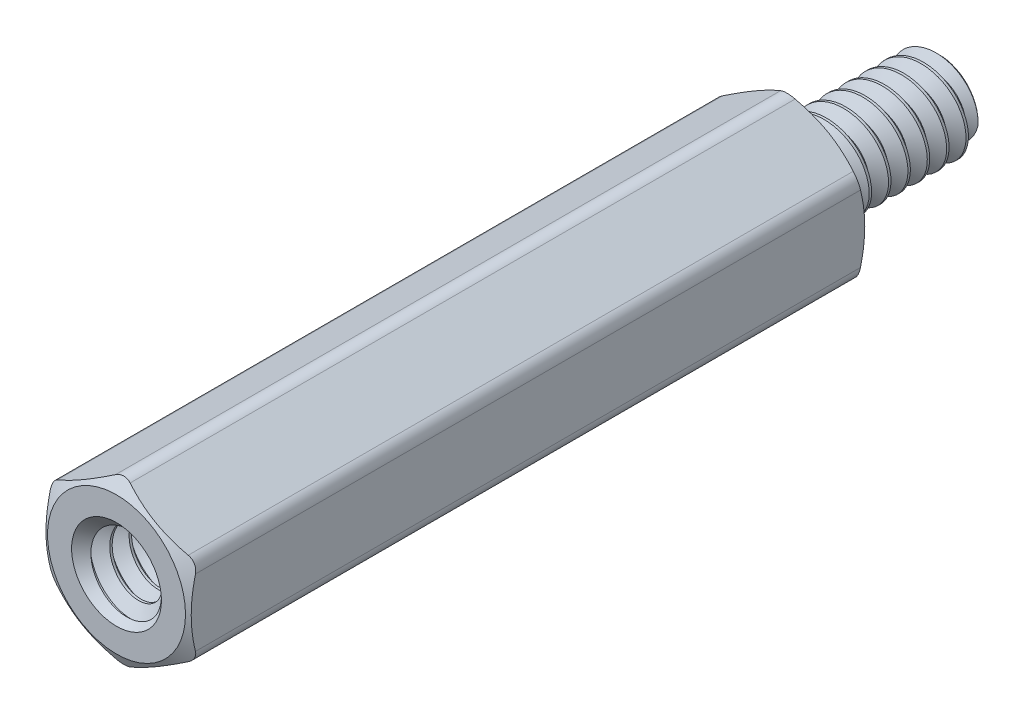
from build123d import *

# Parameters (mm, degrees)
SKETCH4_R           = 1.901825
BOSS_EXTRUDE1_DEPTH = 22.225
SKETCH5_OUTSIDE_W   = 110.15
SKETCH5_OUTSIDE_H   = 110.888
SKETCH5_OUTSIDE_R   = 2.2621875
CUT_EXTRUDE1_DEPTH  = 28.231525417
CUT_EXTRUDE1_DRAFT  = -60
SKETCH6_OUTSIDE_W   = 93.83
SKETCH6_OUTSIDE_H   = 94.568
SKETCH6_OUTSIDE_R   = 2.2621875
CUT_EXTRUDE2_DEPTH  = 23.520689273
CUT_EXTRUDE2_DRAFT  = -60
FILLET1_R           = 0.47625
CUT_SWEEP1_PITCH    = 0.635
SKETCH9_R           = 1.58115
BOSS_EXTRUDE2_DEPTH = 6.35
SKETCH10_W          = 6.35
SKETCH10_H          = 1.4224
CUT_SWEEP2_PITCH    = 0.635


with BuildPart() as part:
    # Sketch3 → Revolve1 (revolve)
    with BuildSketch(Plane(origin=(0, 0, 0), x_dir=(0, 0, -1), z_dir=(1, 0, 0))):
        with BuildLine():
            Line((-15.875, 1.26365), (-15.875, 0))
            Line((-15.875, 0), (4.7625, 0))
            Line((4.7625, 0), (4.7625, 1.26365))
            Line((4.7625, 1.26365), (4.60375, 1.4224))
            Line((4.60375, 1.4224), (0.809625, 1.4224))
            Line((0.809625, 1.4224), (0.5715, 1.009955401))
            Line((0.5715, 1.009955401), (0.15875, 1.009955401))
            ThreePointArc((0.15875, 1.009955401), (0.046496798, 1.0564522), (0, 1.168705401))
            Line((0, 1.168705401), (0, 2.38125))
            Line((0, 2.38125), (-22.225, 2.38125))
            Line((-22.225, 2.38125), (-22.225, 1.58115))
            Line((-22.225, 1.58115), (-22.06625, 1.4224))
            Line((-22.06625, 1.4224), (-16.03375, 1.4224))
            Line((-16.03375, 1.4224), (-15.875, 1.26365))
        make_face()
    revolve(axis=Axis((0, 0, -4.7625), (0, 0, 1)))

    # Sketch4 → Boss-Extrude1 (add)
    with BuildSketch(Plane.XY.offset(22.225)):
        Polygon((-2.38125, 1.374815329), (-2.38125, -1.374815329), (0, -2.749630657), (2.38125, -1.374815329), (2.38125, 1.374815329), (0, 2.749630657), align=None)
        Circle(SKETCH4_R, mode=Mode.SUBTRACT)
    extrude(amount=-BOSS_EXTRUDE1_DEPTH)


with BuildPart() as cut_extrude1_tool:
    # Sketch5 outside → Cut-Extrude1 (with draft: the straight prism first)
    with BuildSketch(Plane.XY.offset(22.225)):
        Rectangle(SKETCH5_OUTSIDE_W, SKETCH5_OUTSIDE_H)
        Circle(SKETCH5_OUTSIDE_R, mode=Mode.SUBTRACT)
    extrude(amount=-CUT_EXTRUDE1_DEPTH)
    # Cut-Extrude1: the draft: its side faces are tilted about the plane it starts from
    cut_extrude1_sides = [cut_extrude1_tool.faces().sort_by_distance(p)[0] for p in [
        (0, -55.444, 8.109237291),
        (55.075, 0, 8.109237291),
        (0, 55.444, 8.109237291),
        (-55.075, 0, 8.109237291),
        (-2.2621875, 0, 8.109237291),
    ]]
    draft(cut_extrude1_sides, Plane.XY.offset(22.225), CUT_EXTRUDE1_DRAFT)


with BuildPart() as part_1:
    add(part.part)

    # Cut-Extrude1: cut by cut_extrude1_tool
    add(cut_extrude1_tool.part, mode=Mode.SUBTRACT)


with BuildPart() as cut_extrude2_tool:
    # Sketch6 outside → Cut-Extrude2 (with draft: the straight prism first)
    with BuildSketch(Plane(origin=(0, 0, 0), x_dir=(-1, 0, 0), z_dir=(0, 0, -1))):
        Rectangle(SKETCH6_OUTSIDE_W, SKETCH6_OUTSIDE_H)
        Circle(SKETCH6_OUTSIDE_R, mode=Mode.SUBTRACT)
    extrude(amount=-CUT_EXTRUDE2_DEPTH)
    # Cut-Extrude2: the draft: its side faces are tilted about the plane it starts from
    cut_extrude2_sides = [cut_extrude2_tool.faces().sort_by_distance(p)[0] for p in [
        (0, -47.284, 11.760344636),
        (-46.915, 0, 11.760344636),
        (0, 47.284, 11.760344636),
        (46.915, 0, 11.760344636),
        (2.2621875, 0, 11.760344636),
    ]]
    draft(cut_extrude2_sides, Plane(origin=(0, 0, 0), x_dir=(-1, 0, 0), z_dir=(0, 0, -1)), CUT_EXTRUDE2_DRAFT)


with BuildPart() as part_2:
    add(part_1.part)

    # Cut-Extrude2: cut by cut_extrude2_tool
    add(cut_extrude2_tool.part, mode=Mode.SUBTRACT)

    # Fillet1
    fillet1_edges = [part_2.edges().sort_by_distance(p)[0] for p in [
        (0, 2.749630657, 11.1125),
        (-2.38125, -1.374815329, 11.1125),
        (0, -2.749630657, 11.1125),
        (2.38125, -1.374815329, 11.1125),
        (2.38125, 1.374815329, 11.1125),
        (-2.38125, 1.374815329, 11.1125),
    ]]
    fillet(fillet1_edges, radius=FILLET1_R)

    # Cut-Sweep1: the profile of Sketch7 profile screwed along a right-hand helix of 7.275 turns, 6 arcs to a turn; built about Z, then put on its axis
    cut_sweep1_z = Axis((0, 0, 0), (0, 0, 1))
    cut_sweep1_corners = [(1.009655401, 0, -0.238298205), (1.009655401, 0, -0.317326795), (1.456770383, 0, -0.57546875), (1.456770383, 0, 0.01984375)]
    with BuildLine(mode=Mode.PRIVATE) as cut_sweep1_profile:
        Line(cut_sweep1_corners[0], cut_sweep1_corners[1])
        Line(cut_sweep1_corners[1], cut_sweep1_corners[2])
        Line(cut_sweep1_corners[2], cut_sweep1_corners[3])
        Line(cut_sweep1_corners[3], cut_sweep1_corners[0])
    cut_sweep1_cap = Face(cut_sweep1_profile.wire())
    cut_sweep1_turn_angles = [0, 30, 60, 90, 120, 150, 180, 210, 240, 270, 300, 330, 360]
    cut_sweep1_turn_weights = [1, 0.8660254037844387, 1, 0.8660254037844387, 1, 0.8660254037844387, 1, 0.8660254037844387, 1, 0.8660254037844387, 1, 0.8660254037844387, 1]
    cut_sweep1_turn_rails = [Edge.make_bspline([Vector(p[0], p[1], 0).rotate(cut_sweep1_z, cut_sweep1_turn_angles[k]) / cut_sweep1_turn_weights[k] + Vector(0, 0, p[2] + CUT_SWEEP1_PITCH * cut_sweep1_turn_angles[k] / 360) for k in range(13)], [0, 0, 0, 1, 1, 2, 2, 3, 3, 4, 4, 5, 5, 6, 6, 6], 2, cut_sweep1_turn_weights) for p in cut_sweep1_corners]
    cut_sweep1_turn_sides = [Face.make_surface_from_curves(cut_sweep1_turn_rails[p[0]], cut_sweep1_turn_rails[p[1]]) for p in [(0, 1), (1, 2), (2, 3), (3, 0)]]
    cut_sweep1_last_angles = [2520, 2550, 2580, 2599.5, 2619]
    cut_sweep1_last_weights = [1, 0.8660254037844387, 1, 0.9426414910921771, 1]
    cut_sweep1_last_rails = [Edge.make_bspline([Vector(p[0], p[1], 0).rotate(cut_sweep1_z, cut_sweep1_last_angles[k]) / cut_sweep1_last_weights[k] + Vector(0, 0, p[2] + CUT_SWEEP1_PITCH * cut_sweep1_last_angles[k] / 360) for k in range(5)], [0, 0, 0, 1, 1, 2, 2, 2], 2, cut_sweep1_last_weights) for p in cut_sweep1_corners]
    cut_sweep1_last_sides = [Face.make_surface_from_curves(cut_sweep1_last_rails[p[0]], cut_sweep1_last_rails[p[1]]) for p in [(0, 1), (1, 2), (2, 3), (3, 0)]]
    cut_sweep1 = Plane(origin=(0, 0, -4.7625), x_dir=(0, 1, 0), z_dir=(0, 0, 1)) * Solid(Shell([*[p.moved(Location((0, 0, CUT_SWEEP1_PITCH * i))) for i in range(7) for p in cut_sweep1_turn_sides], *cut_sweep1_last_sides, cut_sweep1_cap, cut_sweep1_cap.rotate(cut_sweep1_z, 2619).moved(Location((0, 0, CUT_SWEEP1_PITCH * 2619 / 360)))]))
    add(cut_sweep1, mode=Mode.SUBTRACT)

    # Sketch9 → Boss-Extrude2 (add)
    with BuildSketch(Plane.XY.offset(15.875)):
        Circle(SKETCH9_R)
    extrude(amount=BOSS_EXTRUDE2_DEPTH)


with BuildPart() as body_2:
    # Sketch10 → Revolve2 (revolve)
    with BuildSketch(Plane(origin=(0, 0, 0), x_dir=(0, 0, -1), z_dir=(1, 0, 0))):
        with Locations((-19.05, 0.7112)):
            Rectangle(SKETCH10_W, SKETCH10_H)
    revolve(axis=Axis((0, 0, -4.7625), (0, 0, 1)))

    # Cut-Sweep2: the profile of Sketch12 profile screwed along a right-hand helix of 11 turns, 6 arcs to a turn; built about Z, then put on its axis
    cut_sweep2_z = Axis((0, 0, 0), (0, 0, 1))
    cut_sweep2_corners = [(1.009655401, 0, -0.317326795), (1.009655401, 0, -0.238298205), (1.456770383, 0, 0.01984375), (1.456770383, 0, -0.57546875)]
    with BuildLine(mode=Mode.PRIVATE) as cut_sweep2_profile:
        Line(cut_sweep2_corners[0], cut_sweep2_corners[1])
        Line(cut_sweep2_corners[1], cut_sweep2_corners[2])
        Line(cut_sweep2_corners[2], cut_sweep2_corners[3])
        Line(cut_sweep2_corners[3], cut_sweep2_corners[0])
    cut_sweep2_cap = Face(cut_sweep2_profile.wire())
    cut_sweep2_turn_angles = [0, 30, 60, 90, 120, 150, 180, 210, 240, 270, 300, 330, 360]
    cut_sweep2_turn_weights = [1, 0.8660254037844387, 1, 0.8660254037844387, 1, 0.8660254037844387, 1, 0.8660254037844387, 1, 0.8660254037844387, 1, 0.8660254037844387, 1]
    cut_sweep2_turn_rails = [Edge.make_bspline([Vector(p[0], p[1], 0).rotate(cut_sweep2_z, cut_sweep2_turn_angles[k]) / cut_sweep2_turn_weights[k] + Vector(0, 0, p[2] + CUT_SWEEP2_PITCH * cut_sweep2_turn_angles[k] / 360) for k in range(13)], [0, 0, 0, 1, 1, 2, 2, 3, 3, 4, 4, 5, 5, 6, 6, 6], 2, cut_sweep2_turn_weights) for p in cut_sweep2_corners]
    cut_sweep2_turn_sides = [Face.make_surface_from_curves(cut_sweep2_turn_rails[p[0]], cut_sweep2_turn_rails[p[1]]) for p in [(0, 1), (1, 2), (2, 3), (3, 0)]]
    cut_sweep2 = Plane(origin=(0, 0, 22.225), x_dir=(0, 1, 0), z_dir=(0, 0, -1)) * Solid(Shell([*[p.moved(Location((0, 0, CUT_SWEEP2_PITCH * i))) for i in range(11) for p in cut_sweep2_turn_sides], cut_sweep2_cap, cut_sweep2_cap.rotate(cut_sweep2_z, 3960).moved(Location((0, 0, CUT_SWEEP2_PITCH * 3960 / 360)))]))
    add(cut_sweep2, mode=Mode.SUBTRACT)


with BuildPart() as part_3:
    add(part_2.part)

    # Combine1: cut body 2
    add(body_2.part, mode=Mode.SUBTRACT)

    # Cut-Extrude3 cone 1 section (through the dimple's axis) → Cut-Extrude3 (revolve, cut)
    with BuildSketch(Plane(origin=(0, 0, 22.225), x_dir=(0, -1, 0), z_dir=(1, 0, 0))):
        Polygon((0, 0), (1.4732, 0), (0, 1.4732), align=None)
    revolve(axis=Axis((0, 0, 22.225), (0, 0, -1)), mode=Mode.SUBTRACT)


solid = part_3.part
